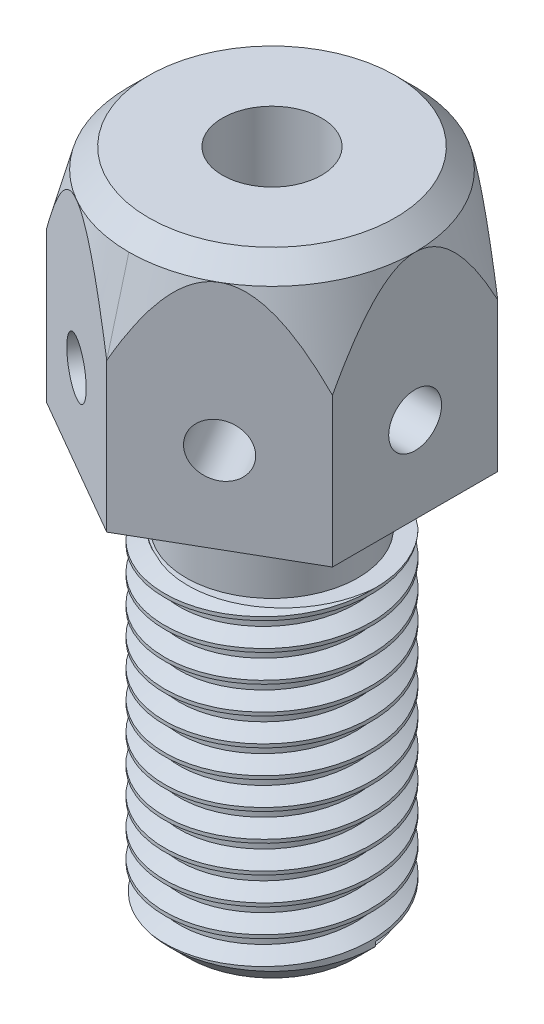
from build123d import *

# Parameters (mm, degrees)
SKETCH2_R           = 3.96875
BOSS_EXTRUDE1_DEPTH = 12.7
CHAMFER1_SIZE       = 0.762
THREAD1_PITCH       = 1.058333333
SKETCH6_R           = 3.302
BOSS_EXTRUDE2_DEPTH = 3.048
BOSS_EXTRUDE3_DEPTH = 8.89
SKETCH9_R           = 1.905
CUT_EXTRUDE1_DEPTH  = 7.874
SKETCH10_R          = 1.016
CUT_EXTRUDE2_DEPTH  = 6.35
CIRPATTERN1_COUNT   = 6
BOSS_EXTRUDE4_START = 0.762
SKETCH13_R          = 5.499261314
SKETCH13_R_2        = 1.905
BOSS_EXTRUDE4_DEPTH = 0.762
CHAMFER2_SIZE       = 0.762


with BuildPart() as part:
    # Sketch2 → Boss-Extrude1 (new body)
    with BuildSketch(Plane(origin=(0, 0, 0), x_dir=(1, 0, 0), z_dir=(0, 1, 0))):
        with Locations(Location((0, 0, 0), (0, 0, 270))):
            Circle(SKETCH2_R)
    extrude(amount=BOSS_EXTRUDE1_DEPTH)

    # Chamfer1
    chamfer1_edges = [part.edges().sort_by_distance(p)[0] for p in [
        (0, 0, -3.96875),
    ]]
    chamfer(chamfer1_edges, length=CHAMFER1_SIZE)

    # Thread1: the profile of Thread Profile1 profile screwed along a right-hand helix of 12 turns, 8 arcs to a turn; built about Z, then put on its axis
    thread1_z = Axis((0, 0, 0), (0, 0, 1))
    thread1_corners = [(3.96905, 0, -0.000173205), (3.96905, 0, 0.926214869), (3.395910282, 0, 0.595312499), (3.395910282, 0, 0.330729165)]
    with BuildLine(mode=Mode.PRIVATE) as thread1_profile:
        Line(thread1_corners[0], thread1_corners[1])
        Line(thread1_corners[1], thread1_corners[2])
        Line(thread1_corners[2], thread1_corners[3])
        Line(thread1_corners[3], thread1_corners[0])
    thread1_cap = Face(thread1_profile.wire())
    thread1_turn_angles = [0, 22.5, 45, 67.5, 90, 112.5, 135, 157.5, 180, 202.5, 225, 247.5, 270, 292.5, 315, 337.5, 360]
    thread1_turn_weights = [1, 0.9238795325112867, 1, 0.9238795325112867, 1, 0.9238795325112867, 1, 0.9238795325112867, 1, 0.9238795325112867, 1, 0.9238795325112867, 1, 0.9238795325112867, 1, 0.9238795325112867, 1]
    thread1_turn_rails = [Edge.make_bspline([Vector(p[0], p[1], 0).rotate(thread1_z, thread1_turn_angles[k]) / thread1_turn_weights[k] + Vector(0, 0, p[2] + THREAD1_PITCH * thread1_turn_angles[k] / 360) for k in range(17)], [0, 0, 0, 1, 1, 2, 2, 3, 3, 4, 4, 5, 5, 6, 6, 7, 7, 8, 8, 8], 2, thread1_turn_weights) for p in thread1_corners]
    thread1_turn_sides = [Face.make_surface_from_curves(thread1_turn_rails[p[0]], thread1_turn_rails[p[1]]) for p in [(0, 1), (1, 2), (2, 3), (3, 0)]]
    thread1 = Plane(origin=(0, 0, 0), x_dir=(1, 0, 0), z_dir=(0, 1, 0)) * Solid(Shell([*[p.moved(Location((0, 0, THREAD1_PITCH * i))) for i in range(12) for p in thread1_turn_sides], thread1_cap, thread1_cap.rotate(thread1_z, 4320).moved(Location((0, 0, THREAD1_PITCH * 4320 / 360)))]))
    add(thread1, mode=Mode.SUBTRACT)

    # Sketch6 → Boss-Extrude2 (add)
    with BuildSketch(Plane(origin=(0, 12.7, 0), x_dir=(1, 0, 0), z_dir=(0, 1, 0))):
        with Locations(Location((0, 0, 0), (0, 0, 90))):
            Circle(SKETCH6_R)
    extrude(amount=BOSS_EXTRUDE2_DEPTH)

    # Sketch8 → Boss-Extrude3 (add)
    with BuildSketch(Plane(origin=(0, 15.748, 0), x_dir=(1, 0, 0), z_dir=(0, 1, 0))):
        Polygon((0, -6.35), (5.499261314, -3.175), (5.499261314, 3.175), (0, 6.35), (-5.499261314, 3.175), (-5.499261314, -3.175), align=None)
    extrude(amount=BOSS_EXTRUDE3_DEPTH)

    # Sketch9 → Cut-Extrude1 (cut)
    with BuildSketch(Plane(origin=(0, 24.638, 0), x_dir=(1, 0, 0), z_dir=(0, 1, 0))):
        with Locations(Location((0, 0, 0), (0, 0, 270))):
            Circle(SKETCH9_R)
    extrude(amount=-CUT_EXTRUDE1_DEPTH, mode=Mode.SUBTRACT)

    # Sketch10 → Cut-Extrude2 (cut)
    with BuildSketch(Plane(origin=(-2.749630657, 0, -4.7625), x_dir=(-0.8660254037844384, 0, 0.5000000000000004), z_dir=(-0.5000000000000004, 0, -0.8660254037844384))):
        with Locations((0, 19.05)):
            Circle(SKETCH10_R)
    cut_extrude2 = extrude(amount=-CUT_EXTRUDE2_DEPTH, mode=Mode.SUBTRACT)

    # CirPattern1: Cut-Extrude2 ×6 about axis
    cirpattern1_axis = Axis((0, 24.638, 0), (0, 1, 0))
    for i in range(1, CIRPATTERN1_COUNT):
        add(cut_extrude2.rotate(cirpattern1_axis, i * 360 / CIRPATTERN1_COUNT), mode=Mode.SUBTRACT)

    # Cut-Sweep2: sweep along a path in Sketch12
    with BuildLine(Plane(origin=(0, 24.638, 0), x_dir=(1, 0, 0), z_dir=(0, 1, 0))) as cut_sweep2_path:
        CenterArc((0, 0), 5.499261314, 0, 360)
    # Sketch11 → Cut-Sweep2 (sweep, cut)
    with BuildSketch(Plane(origin=(0, 0, 0), x_dir=(0, 0, -1), z_dir=(1, 0, 0))):
        Polygon((-6.35, 24.638), (-5.499261314, 24.638), (-6.35, 21.463), align=None)
    sweep(path=cut_sweep2_path.line, mode=Mode.SUBTRACT)

    # Sketch13 → Boss-Extrude4 (add)
    with BuildSketch(Plane(origin=(0, 24.638, 0), x_dir=(1, 0, 0), z_dir=(0, 1, 0)).offset(BOSS_EXTRUDE4_START)):
        with Locations(Location((0, 0, 0), (0, 0, 270))):
            Circle(SKETCH13_R)
        with Locations(Location((0, 0, 0), (0, 0, 270))):
            Circle(SKETCH13_R_2, mode=Mode.SUBTRACT)
    extrude(amount=-BOSS_EXTRUDE4_DEPTH)

    # Chamfer2
    chamfer2_edges = [part.edges().sort_by_distance(p)[0] for p in [
        (0, 25.4, -5.499261314),
    ]]
    chamfer(chamfer2_edges, length=CHAMFER2_SIZE - 0.0001)  # a hair under: the kernel refuses the full size


solid = part.part
